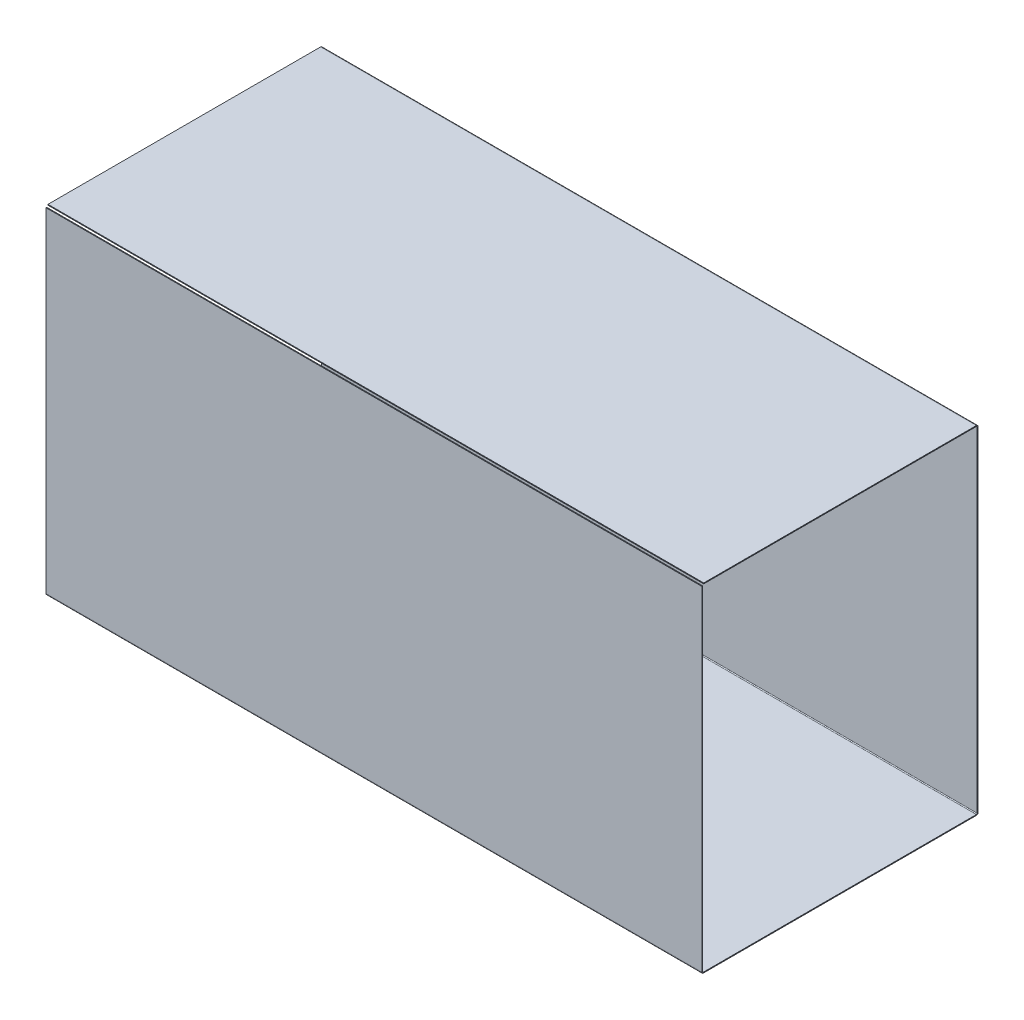
from build123d import *

# Parameters (mm, degrees)
SKETCH1_W              = 800
SKETCH1_H              = 410
BOSS_EXTRUDE1_DEPTH    = 167.5
CONVERT_SOLID1_DEPTH   = 800
CONVERT_SOLID1_2_DEPTH = 800


# Read off the part's stored shape, not the designer's step: Convert-Solid1
with BuildPart() as part:
    # Sketch1 → Boss-Extrude1 (new, symmetric)
    with BuildSketch(Plane.XY):
        with Locations((400, 80)):
            Rectangle(SKETCH1_W, SKETCH1_H)
    extrude(amount=BOSS_EXTRUDE1_DEPTH, both=True)

    # Convert-Solid1 outline → Convert-Solid1 (cut)
    with BuildSketch(Plane.YZ):
        with BuildLine():
            Line((285, 167.5), (-124, 167.5))
            ThreePointArc((-124, 167.5), (-124.707106781, 167.207106781), (-125, 166.5))
            Line((-125, 166.5), (-125, -166.5))
            ThreePointArc((-125, -166.5), (-124.707106781, -167.207106781), (-124, -167.5))
            Line((-124, -167.5), (284, -167.5))
            ThreePointArc((284, -167.5), (284.707106781, -167.207106781), (285, -166.5))
            Line((285, -166.5), (285, 167.5))
        make_face()
    extrude(amount=CONVERT_SOLID1_DEPTH, mode=Mode.SUBTRACT)

    # Convert-Solid1 2 outline → Convert-Solid1 2 (add)
    with BuildSketch(Plane.YZ):
        with BuildLine():
            Line((-125, 167.5), (283.585786438, 167.5))
            Line((283.585786438, 167.5), (283.585786438, 168.5))
            Line((283.585786438, 168.5), (-124, 168.5))
            ThreePointArc((-124, 168.5), (-125.414213562, 167.914213562), (-126, 166.5))
            Line((-126, 166.5), (-126, -166.5))
            ThreePointArc((-126, -166.5), (-125.414213562, -167.914213562), (-124, -168.5))
            Line((-124, -168.5), (284, -168.5))
            ThreePointArc((284, -168.5), (285.414213562, -167.914213562), (286, -166.5))
            Line((286, -166.5), (286, 166.085786438))
            Line((286, 166.085786438), (285, 166.085786438))
            Line((285, 166.085786438), (285, -167.5))
            Line((285, -167.5), (-125, -167.5))
            Line((-125, -167.5), (-125, 167.5))
        make_face()
    extrude(amount=CONVERT_SOLID1_2_DEPTH)


solid = part.part
